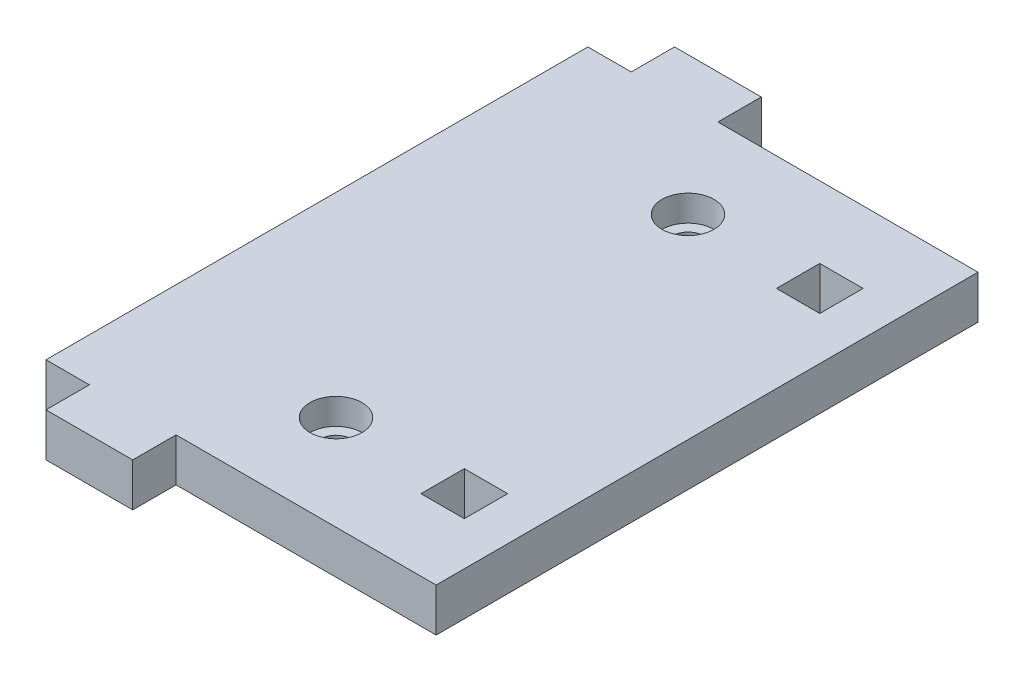
from build123d import *

# Parameters (mm, degrees)
SKETCH1_R           = 1.75
SKETCH1_W           = 5
SKETCH1_H           = 5
BOSS_EXTRUDE1_DEPTH = 5
SKETCH2_R           = 3
CUT_EXTRUDE1_DEPTH  = 3


with BuildPart() as part:
    # Sketch1 → Boss-Extrude1 (new body)
    with BuildSketch(Plane(origin=(0, 0, 0), x_dir=(1, 0, 0), z_dir=(0, 1, 0))):
        Polygon((-21.909620991, 19.482507289), (-21.909620991, -43.017492711), (-16.909620991, -43.017492711), (-16.909620991, -48.017492711), (-6.909620991, -48.017492711), (-6.909620991, -43.017492711), (23.090379009, -43.017492711), (23.090379009, 19.482507289), (-6.909620991, 19.482507289), (-6.909620991, 24.482507289), (-16.909620991, 24.482507289), (-16.909620991, 19.482507289), align=None)
        with Locations((0.590379009, 8.532507289)):
            Circle(SKETCH1_R, mode=Mode.SUBTRACT)
        with Locations((15.590379009, 8.732507289)):
            Rectangle(SKETCH1_W, SKETCH1_H, mode=Mode.SUBTRACT)
        with Locations((15.590379009, -32.267492711)):
            Rectangle(SKETCH1_W, SKETCH1_H, mode=Mode.SUBTRACT)
        with Locations((0.590379009, -32.067492711)):
            Circle(SKETCH1_R, mode=Mode.SUBTRACT)
    extrude(amount=BOSS_EXTRUDE1_DEPTH)

    # Sketch2 → Cut-Extrude1 (cut)
    with BuildSketch(Plane(origin=(0, 5, 0), x_dir=(1, 0, 0), z_dir=(0, 1, 0))):
        with Locations((0.590379009, -32.067492711)):
            Circle(SKETCH2_R)
        with Locations((0.590379009, 8.532507289)):
            Circle(SKETCH2_R)
    extrude(amount=-CUT_EXTRUDE1_DEPTH, mode=Mode.SUBTRACT)


solid = part.part
